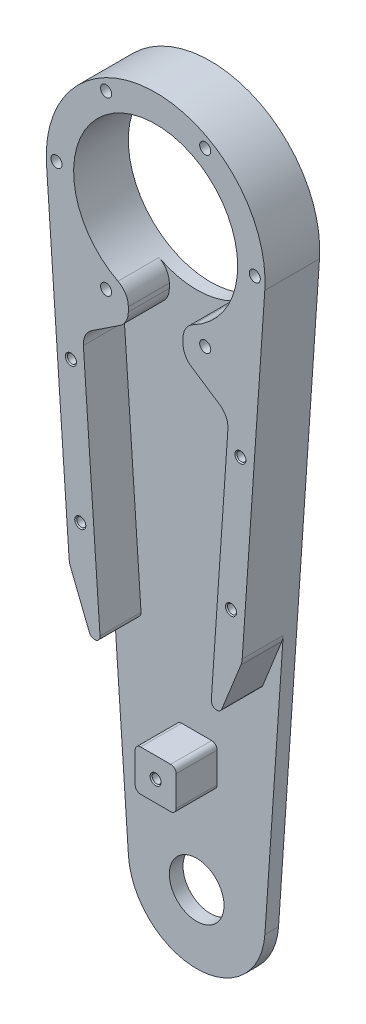
from build123d import *
from build123d.topology import SkipClean

# Parameters (mm, degrees)
SKETCH1_R                       = 40
SKETCH1_R_2                     = 30
BOSS_EXTRUDE1_DEPTH             = 5
M4X0_7_TAPPED_HOLE1_D           = 3.3
M4X0_7_TAPPED_HOLE1_CSINK_D     = 4.05
M4X0_7_TAPPED_HOLE1_CSINK_ANGLE = 90
CIRPATTERN1_COUNT               = 6
SKETCH14_R                      = 10
BOSS_EXTRUDE5_DEPTH             = 5
BOSS_EXTRUDE7_START             = 15
SKETCH15_R                      = 2.025
SKETCH15_W                      = 15
SKETCH15_H                      = 15
BOSS_EXTRUDE7_DEPTH             = 15
M4X0_7_TAPPED_HOLE2_D           = 3.3
M4X0_7_TAPPED_HOLE2_DEPTH       = 15
M4X0_7_TAPPED_HOLE2_CSINK_D     = 4.05
M4X0_7_TAPPED_HOLE2_CSINK_ANGLE = 90
M4X0_7_TAPPED_HOLE2_TIP         = 0.991420021
FILLET1_R                       = 7
FILLET2_R                       = 2


with BuildPart() as part:
    # Sketch1 → Boss-Extrude1 (new body)
    with BuildSketch(Plane.XY):
        Circle(SKETCH1_R)
        Circle(SKETCH1_R_2, mode=Mode.SUBTRACT)
    extrude(amount=-BOSS_EXTRUDE1_DEPTH)

    # M4x0.7 Tapped Hole1 (through all)
    with Locations(Plane.XY):
        with Locations((36.25, 0)):
            m4x0_7_tapped_hole1 = CounterSinkHole(M4X0_7_TAPPED_HOLE1_D / 2, M4X0_7_TAPPED_HOLE1_CSINK_D / 2, counter_sink_angle=M4X0_7_TAPPED_HOLE1_CSINK_ANGLE)

    # CirPattern1: M4x0.7 Tapped Hole1 ×6 about axis
    cirpattern1_axis = Axis((0, 0, 0), (0, 0, 1))
    for i in range(1, CIRPATTERN1_COUNT):
        add(m4x0_7_tapped_hole1.rotate(cirpattern1_axis, i * 360 / CIRPATTERN1_COUNT), mode=Mode.SUBTRACT)

    # Sketch14 → Boss-Extrude5 (add)
    with BuildSketch(Plane.XY):
        with BuildLine():
            ThreePointArc((39.906916487, -2.727272727), (0, -40), (-39.906916487, -2.727272727))
            Line((-39.906916487, -2.727272727), (-24.941822804, -221.704545455))
            ThreePointArc((-24.941822804, -221.704545455), (0, -245), (24.941822804, -221.704545455))
            Line((24.941822804, -221.704545455), (39.906916487, -2.727272727))
        make_face()
        with Locations((0, -220)):
            Circle(SKETCH14_R, mode=Mode.SUBTRACT)
    extrude(amount=-BOSS_EXTRUDE5_DEPTH)

    # Sketch15 → Boss-Extrude7 (add)
    # profile 1 of 2: a face of its own
    with SkipClean():  # the faces are left unmerged after this step: merging them gives an invalid solid
        with BuildSketch(Plane.XY.offset(BOSS_EXTRUDE7_START)):
            with BuildLine():
                Line((-39.906916487, -2.727272727), (-31.570605203, -124.708648069))
                Line((-31.570605203, -124.708648069), (-19.477143205, -155))
                Line((-19.477143205, -155), (-26.701678828, -49.28672208))
                Line((-26.701678828, -49.28672208), (-10, -38.284271247))
                Line((-10, -38.284271247), (-10, -28.284271247))
                ThreePointArc((-10, -28.284271247), (0, 30), (10, -28.284271247))
                Line((10, -28.284271247), (10, -38.284271247))
                Line((10, -38.284271247), (26.701678828, -49.28672208))
                Line((26.701678828, -49.28672208), (19.477143205, -155))
                Line((19.477143205, -155), (31.570605203, -124.708648069))
                Line((31.570605203, -124.708648069), (39.906916487, -2.727272727))
                ThreePointArc((39.906916487, -2.727272727), (0, 40), (-39.906916487, -2.727272727))
            make_face()
            with Locations((-18.125, -31.393420887)):
                Circle(SKETCH15_R, mode=Mode.SUBTRACT)
            with Locations((-36.25, 0)):
                Circle(SKETCH15_R, mode=Mode.SUBTRACT)
            with Locations((-18.125, 31.393420887)):
                Circle(SKETCH15_R, mode=Mode.SUBTRACT)
            with Locations((36.25, 0)):
                Circle(SKETCH15_R, mode=Mode.SUBTRACT)
            with Locations((18.125, -31.393420887)):
                Circle(SKETCH15_R, mode=Mode.SUBTRACT)
            with Locations((18.125, 31.393420887)):
                Circle(SKETCH15_R, mode=Mode.SUBTRACT)
        # profile 2 of 2: a face of its own
        with BuildSketch(Plane.XY.offset(BOSS_EXTRUDE7_START)):
            with Locations((0, -177.5)):
                Rectangle(SKETCH15_W, SKETCH15_H)
        extrude(amount=-BOSS_EXTRUDE7_DEPTH)

    # M4x0.7 Tapped Hole2
    with Locations(Plane.XY.offset(15)):
        with Locations((0, -177.5), (-27.564144185, -110), (27.564144185, -110), (-30.981186852, -60), (30.981186852, -60)):
            CounterSinkHole(M4X0_7_TAPPED_HOLE2_D / 2, M4X0_7_TAPPED_HOLE2_CSINK_D / 2, depth=M4X0_7_TAPPED_HOLE2_DEPTH, counter_sink_angle=M4X0_7_TAPPED_HOLE2_CSINK_ANGLE)
            with Locations((0, 0, -(M4X0_7_TAPPED_HOLE2_DEPTH + M4X0_7_TAPPED_HOLE2_TIP / 2))):  # 118° drill point
                Cone(0, M4X0_7_TAPPED_HOLE2_D / 2, M4X0_7_TAPPED_HOLE2_TIP, mode=Mode.SUBTRACT)

    # Fillet1
    # the kernel refuses this fillet: 7 mm, written as the material it adds along each edge
    with BuildSketch(Plane(origin=(-26.701678828, -49.28672208, 15), x_dir=(0.8350839414170254, 0.5501225416099637, 0), z_dir=(0, 0, -1))) as fillet1_piece_1:
        with BuildLine():
            CenterArc((FILLET1_R * 0.583582124754, FILLET1_R), FILLET1_R, 209.465856716, 60.534143284)
            Line((-FILLET1_R * 0.287066858092, FILLET1_R * 0.508095183324), (0, 0))
            Line((0, 0), (FILLET1_R * 0.583582124754, 0))
        make_face()
    extrude(amount=15)
    with BuildSketch(Plane(origin=(26.701678828, -49.28672208, 15), x_dir=(-0.8350839414170222, 0.5501225416099685, 0), z_dir=(0, 0, -1))) as fillet1_piece_2:
        with BuildLine():
            CenterArc((FILLET1_R * 0.583582124754, -FILLET1_R), FILLET1_R, 90, 60.534143284)
            Line((-FILLET1_R * 0.287066858092, -FILLET1_R * 0.508095183324), (0, 0))
            Line((0, 0), (FILLET1_R * 0.583582124754, 0))
        make_face()
    extrude(amount=15)
    # the kernel refuses this fillet: 7 mm, written as the material it takes off along each edge
    with BuildSketch(Plane(origin=(-31.570605203, -124.708648069, 17.748908315), x_dir=(-0.06818181818181737, 0.9976729121658168, 0), z_dir=(0, 0, -1))) as fillet1_2_piece_1:
        with BuildLine():
            CenterArc((FILLET1_R * 0.157080475159, FILLET1_R), FILLET1_R, 252.145796046, 17.854203954)
            Line((-FILLET1_R * 0.149515442954, FILLET1_R * 0.048160232499), (0, 0))
            Line((0, 0), (FILLET1_R * 0.157080475159, 0))
        make_face()
    extrude(amount=17.748908315, mode=Mode.SUBTRACT)
    with BuildSketch(Plane(origin=(-10, -38.284271247, 24.427621741), x_dir=(0, 1, 0), z_dir=(0, 0, -1))) as fillet1_2_piece_2:
        with BuildLine():
            CenterArc((FILLET1_R * 0.538721242354, -FILLET1_R), FILLET1_R, 90, 56.624579759)
            Line((-FILLET1_R * 0.296362699063, -FILLET1_R * 0.44987745839), (0, 0))
            Line((0, 0), (FILLET1_R * 0.538721242354, 0))
        make_face()
    extrude(amount=24.427621741, mode=Mode.SUBTRACT)
    with BuildSketch(Plane(origin=(-10, -28.284271247, 26.447705507), x_dir=(-0.9176733218940842, 0.39733571986907557, 0), z_dir=(0, 0, -1))) as fillet1_2_piece_3:
        with BuildLine():
            CenterArc((4.60428033, -6.983451615), FILLET1_R, 93.940506137, 62.647767091)
            Line((-1.819432923, -4.202101576), (0, 0))
            ThreePointArc((0, 0), (2.061618058, -0.070921648), (4.123236116, 0))
        make_face()
    extrude(amount=26.447705507, mode=Mode.SUBTRACT)
    with BuildSketch(Plane(origin=(10, -28.284271247, 26.447705507), x_dir=(0, -1, 0), z_dir=(0, 0, -1))) as fillet1_2_piece_4:
        with BuildLine():
            CenterArc((4.579082203, -7), FILLET1_R, 90, 62.647767091)
            ThreePointArc((-1.63830899, -3.783783784), (-0.754071591, -1.920071596), (0, 0))
            Line((0, 0), (4.579082203, 0))
        make_face()
    extrude(amount=26.447705507, mode=Mode.SUBTRACT)
    with BuildSketch(Plane(origin=(10, -38.284271247, 24.427621741), x_dir=(0, 1, 0), z_dir=(0, 0, -1))) as fillet1_2_piece_5:
        with BuildLine():
            CenterArc((FILLET1_R * 0.538721242354, FILLET1_R), FILLET1_R, 213.375420241, 56.624579759)
            Line((-FILLET1_R * 0.296362699063, FILLET1_R * 0.44987745839), (0, 0))
            Line((0, 0), (FILLET1_R * 0.538721242354, 0))
        make_face()
    extrude(amount=24.427621741, mode=Mode.SUBTRACT)
    with BuildSketch(Plane(origin=(31.570605203, -124.708648069, 17.748908315), x_dir=(0.06818181818181737, 0.9976729121658168, 0), z_dir=(0, 0, -1))) as fillet1_2_piece_6:
        with BuildLine():
            CenterArc((FILLET1_R * 0.157080475159, -FILLET1_R), FILLET1_R, 90, 17.854203954)
            Line((-FILLET1_R * 0.149515442954, -FILLET1_R * 0.048160232499), (0, 0))
            Line((0, 0), (FILLET1_R * 0.157080475159, 0))
        make_face()
    extrude(amount=17.748908315, mode=Mode.SUBTRACT)

    # Fillet2
    fillet2_edges = [part.edges().sort_by_distance(p)[0] for p in [
        (7.5, -170, 7.5),
        (-7.5, -170, 7.5),
        (-7.5, -185, 7.5),
        (7.5, -185, 7.5),
        (-19.477143205, -155, 7.5),
        (19.477143205, -155, 7.5),
    ]]
    fillet(fillet2_edges, radius=FILLET2_R)


solid = part.part
